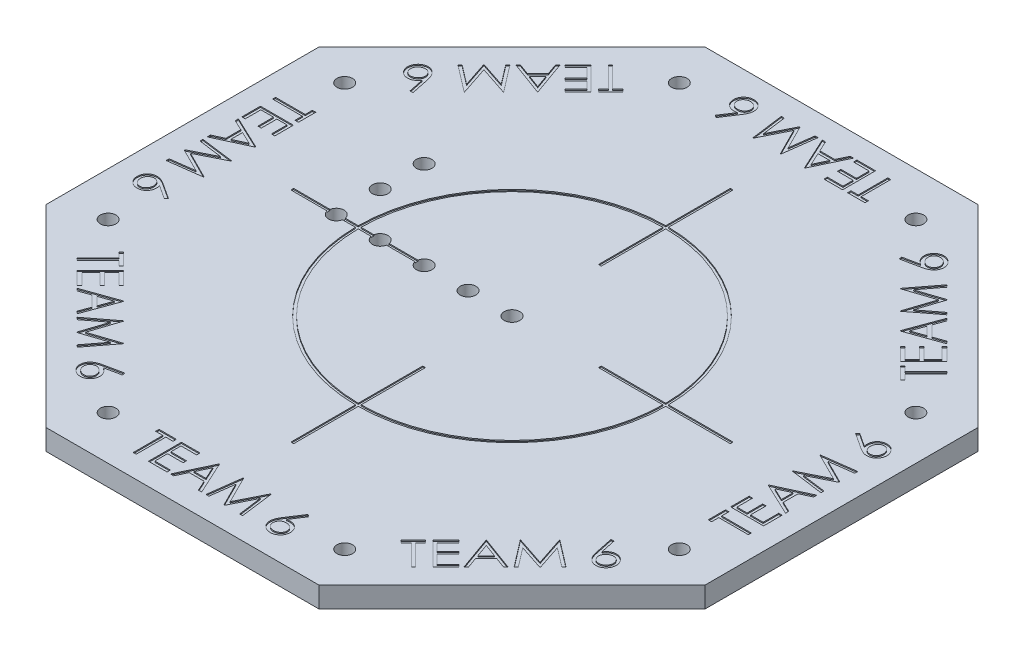
from build123d import *

# Parameters (mm, degrees)
BASE_DEPTH              = 5.9944
MOUNTING_HOLES_D        = 4.4958
F_8_CLEARANCE_HOLE1_D   = 4.4958
CUT_EXTRUDE1_DEPTH      = 0.3175
CIRPATTERN1_COUNT       = 8
SKETCH9_R               = 44.846875
SKETCH9_R_2             = 44.053125
SKETCH9_W               = 0.79375
SKETCH9_H               = 38.1
SKETCH9_W_2             = 38.1
SKETCH9_H_2             = 0.79375
CUT_EXTRUDE_THIN2_DEPTH = 0.3175


with BuildPart() as part:
    # Sketch1 → Base (new body)
    with BuildSketch(Plane(origin=(0, 0, 0), x_dir=(1, 0, 0), z_dir=(0, 1, 0))):
        Polygon((-39.453841816, 95.25), (-95.25, 39.453841816), (-95.25, -39.453841816), (-39.453841816, -95.25), (39.453841816, -95.25), (95.25, -39.453841816), (95.25, 39.453841816), (39.453841816, 95.25), align=None)
    extrude(amount=BASE_DEPTH)

    # Mounting holes (through all)
    with Locations(Plane(origin=(0, 5.9944, 0), x_dir=(1, 0, 0), z_dir=(0, 1, 0))):
        with Locations((-34.193329574, 82.55), (34.193329574, 82.55), (82.55, 34.193329574), (82.55, -34.193329574), (34.193329574, -82.55), (-34.193329574, -82.55), (-82.55, -34.193329574), (-82.55, 34.193329574)):
            Hole(MOUNTING_HOLES_D / 2)

    # #8 Clearance Hole1 (through all)
    with Locations(Plane(origin=(0, 5.9944, 0), x_dir=(1, 0, 0), z_dir=(0, 1, 0))):
        with Locations((0, 0), (-12.7, 0), (-25.4, 0), (-38.1, 0), (-50.8, 0), (-50.8, 12.7), (-50.8, 25.4)):
            Hole(F_8_CLEARANCE_HOLE1_D / 2)

    # Sketch8 → Cut-Extrude1 (cut)
    # profile 1 of 5: a face of its own
    with BuildSketch(Plane(origin=(0, 5.9944, 0), x_dir=(1, 0, 0), z_dir=(0, 1, 0))):
        Polygon((-22.652403846, -80.351923077), (-22.652403846, -79.375), (-17.645673077, -79.375), (-17.645673077, -80.351923077), (-19.721634615, -80.351923077), (-19.721634615, -88.9), (-20.576442308, -88.9), (-20.576442308, -80.351923077), align=None)
    # profile 2 of 5: a face of its own
    with BuildSketch(Plane(origin=(0, 5.9944, 0), x_dir=(1, 0, 0), z_dir=(0, 1, 0))):
        Polygon((-16.180288462, -79.375), (-10.807211538, -79.375), (-10.807211538, -80.351923077), (-15.325480769, -80.351923077), (-15.325480769, -83.282692308), (-10.807211538, -83.282692308), (-10.807211538, -84.259615385), (-15.325480769, -84.259615385), (-15.325480769, -87.923076923), (-10.807211538, -87.923076923), (-10.807211538, -88.9), (-16.180288462, -88.9), align=None)
    # profile 3 of 5: a face of its own
    with BuildSketch(Plane(origin=(0, 5.9944, 0), x_dir=(1, 0, 0), z_dir=(0, 1, 0))):
        Polygon((-5.189903846, -79.375), (-0.79375, -88.9), (-1.722971755, -88.9), (-3.131114784, -85.847115385), (-7.449038462, -85.847115385), (-8.897250601, -88.9), (-9.830288462, -88.9), (-5.312019231, -79.375), align=None)
        Polygon((-5.260501803, -81.231535457), (-6.985381611, -84.870192308), (-3.581415264, -84.870192308), align=None, mode=Mode.SUBTRACT)
    # profile 4 of 5: a face of its own
    with BuildSketch(Plane(origin=(0, 5.9944, 0), x_dir=(1, 0, 0), z_dir=(0, 1, 0))):
        Polygon((0.427403846, -88.9), (1.684810697, -79.375), (1.806926082, -79.375), (5.739423077, -87.190384615), (9.662379808, -79.375), (9.786403245, -79.375), (11.051442308, -88.9), (10.19281851, -88.9), (9.280769231, -82.046274038), (5.842457933, -88.9), (5.649744591, -88.9), (2.198076923, -82.031009615), (1.287935697, -88.9), align=None)
    # profile 5 of 5: a face of its own
    with BuildSketch(Plane(origin=(0, 5.9944, 0), x_dir=(1, 0, 0), z_dir=(0, 1, 0))):
        with BuildLine():
            Line((20.210096154, -79.130769231), (20.868374399, -79.647851563))
            Line((20.868374399, -79.647851563), (18.351652644, -83.496394231))
            add(Edge.make_bspline(
                [(18.351652644, -83.496394231), (18.519211755, -83.46968651), (18.846054746, -83.417590081), (19.176887656, -83.408995958), (19.338115986, -83.404807692)],
                knots=[0, 0, 0, 0, 1.025318673, 2, 2, 2, 2], degree=3))
            add(Edge.make_bspline(
                [(19.338115986, -83.404807692), (19.434923993, -83.407409682), (19.625487676, -83.412531621), (19.905269045, -83.451948386), (20.174116078, -83.514065298), (20.430914465, -83.604613366), (20.676585938, -83.720280488), (20.912540315, -83.858906985), (21.134342214, -84.027651015), (21.344847924, -84.216150644), (21.535965953, -84.424930438), (21.705173647, -84.646458361), (21.84730513, -84.880503616), (21.962622731, -85.126947658), (22.052171008, -85.3854106), (22.11745167, -85.655561751), (22.156040419, -85.937587399), (22.161280505, -86.129388719), (22.163942308, -86.226817909)],
                knots=[0, 0, 0, 0, 1.04369286, 2.054478336, 3.041073146, 4.015093852, 4.984733326, 5.965804835, 6.960378782, 7.985147595, 9.009457201, 10.008161701, 10.986880575, 11.956520048, 12.937015923, 13.931873656, 14.949455224, 16, 16, 16, 16], degree=3))
            add(Edge.make_bspline(
                [(22.163942308, -86.226817909), (22.160069429, -86.360112674), (22.152448521, -86.622405228), (22.076510334, -87.004430408), (21.958510158, -87.368373896), (21.789842741, -87.708425027), (21.580340685, -88.024117734), (21.324859522, -88.303841037), (21.032459743, -88.553314495), (20.701842099, -88.761930009), (20.346034461, -88.932299741), (19.972240811, -89.054669435), (19.58409122, -89.13000802), (19.320644394, -89.139453017), (19.187379808, -89.144230769)],
                knots=[0, 0, 0, 0, 1.031375318, 2.029502543, 3.004789286, 3.987476834, 4.960371455, 5.9300674, 6.912260825, 7.929083631, 8.949397511, 9.960523116, 10.96833055, 12, 12, 12, 12], degree=3))
            add(Edge.make_bspline(
                [(19.187379808, -89.144230769), (19.059209501, -89.140071866), (18.805326564, -89.131833808), (18.431857317, -89.058447934), (18.073001534, -88.939502176), (17.731273433, -88.775633318), (17.414715194, -88.568647222), (17.131507997, -88.31946702), (16.883063954, -88.033419119), (16.67630445, -87.710547888), (16.512314615, -87.363593075), (16.389333461, -87.001814099), (16.317497971, -86.626529149), (16.307459827, -86.372126906), (16.302403846, -86.243990385)],
                knots=[0, 0, 0, 0, 1.012016664, 2.004627821, 2.994792927, 3.992885782, 4.990978636, 5.973936114, 6.964471063, 7.975201453, 8.993600317, 9.990122807, 10.98767138, 12, 12, 12, 12], degree=3))
            add(Edge.make_bspline(
                [(16.302403846, -86.243990385), (16.305619064, -86.145897626), (16.312183926, -85.945610955), (16.358022009, -85.642269565), (16.431676915, -85.331887692), (16.514164086, -85.068578066), (16.601319496, -84.852873495), (16.673852478, -84.67896471), (16.764133139, -84.500000646), (16.860399269, -84.309844537), (16.971316177, -84.113397038), (17.091918051, -83.907374909), (17.225539244, -83.695054692), (17.319211258, -83.550970846), (17.367097356, -83.477313702)],
                knots=[0, 0, 0, 0, 1.173818275, 2.396712641, 3.66331629, 4.989737886, 5.693666774, 6.447286557, 7.243889047, 8.091586357, 8.998013824, 9.943181721, 10.948533338, 12, 12, 12, 12], degree=3))
            Line((17.367097356, -83.477313702), (20.210096154, -79.130769231))
        make_face()
        with BuildLine():
            add(Edge.make_bspline(
                [(19.158759014, -84.381730769), (19.08619962, -84.38384816), (18.944470043, -84.387984038), (18.736532722, -84.412001331), (18.539737373, -84.457228931), (18.351476745, -84.514831591), (18.175270497, -84.594033489), (18.009838011, -84.690240885), (17.854539548, -84.803509948), (17.71100174, -84.932235999), (17.580863942, -85.073173432), (17.468792436, -85.224129774), (17.372120761, -85.381466999), (17.293520954, -85.546499713), (17.232315819, -85.71916483), (17.188042937, -85.898668215), (17.163403799, -86.086213577), (17.159304698, -86.213392745), (17.157211538, -86.278335337)],
                knots=[0, 0, 0, 0, 1.129588631, 2.206414736, 3.251139165, 4.268635594, 5.265702196, 6.250456724, 7.242448911, 8.251968645, 9.246821453, 10.222880186, 11.173611482, 12.116736599, 13.062300278, 14.020270554, 14.989073742, 16, 16, 16, 16], degree=3))
            add(Edge.make_bspline(
                [(17.157211538, -86.278335337), (17.158916136, -86.342697068), (17.162258599, -86.46890084), (17.192608841, -86.654881036), (17.238968601, -86.833855537), (17.307930678, -87.004901674), (17.390190996, -87.170626653), (17.498790485, -87.32502768), (17.619123309, -87.4774823), (17.762961514, -87.616279161), (17.917330094, -87.745428974), (18.082251938, -87.858314521), (18.254137258, -87.954887607), (18.435306628, -88.030573523), (18.623189659, -88.092688189), (18.819351738, -88.136398358), (19.023929295, -88.161110361), (19.162509712, -88.165214802), (19.233173077, -88.167307692)],
                knots=[0, 0, 0, 0, 0.989467248, 1.94019797, 2.891935182, 3.827694429, 4.772920941, 5.730924762, 6.725747692, 7.756678648, 8.79901574, 9.819492441, 10.826891316, 11.826466727, 12.835195252, 13.867842842, 14.912794438, 16, 16, 16, 16], degree=3))
            add(Edge.make_bspline(
                [(19.233173077, -88.167307692), (19.303836326, -88.165214638), (19.442416516, -88.161109875), (19.646995719, -88.136400205), (19.843151715, -88.092681413), (20.031056856, -88.030598088), (20.212144608, -87.954796479), (20.3838796, -87.858915326), (20.547241769, -87.744734748), (20.701711686, -87.616499869), (20.84495119, -87.476692322), (20.96817007, -87.326388577), (21.073443726, -87.169378762), (21.158989621, -87.005554504), (21.227192135, -86.833752113), (21.273786985, -86.654908743), (21.30407455, -86.468893587), (21.307425625, -86.342694618), (21.309134615, -86.278335337)],
                knots=[0, 0, 0, 0, 1.087397944, 2.132534446, 3.165364764, 4.174271784, 5.174024072, 6.181601208, 7.194203697, 8.236725232, 9.267838612, 10.269026844, 11.221737037, 12.171628256, 13.107553087, 14.05945871, 15.010357665, 16, 16, 16, 16], degree=3))
            add(Edge.make_bspline(
                [(21.309134615, -86.278335337), (21.307637032, -86.213308023), (21.304697764, -86.085680554), (21.271452932, -85.898752108), (21.225345472, -85.718252796), (21.155723081, -85.545317035), (21.065272199, -85.380627262), (20.955099498, -85.223351548), (20.827648003, -85.072284103), (20.680425413, -84.931959603), (20.520159848, -84.803652198), (20.349756005, -84.690387548), (20.171480734, -84.594797433), (19.98551479, -84.515040247), (19.789727374, -84.457483464), (19.58727938, -84.412162853), (19.375581512, -84.388045504), (19.231953742, -84.383862491), (19.158759014, -84.381730769)],
                knots=[0, 0, 0, 0, 0.978206639, 1.919901502, 2.851605144, 3.780102724, 4.718870031, 5.675451981, 6.667674623, 7.690630536, 8.733308323, 9.756129687, 10.767539656, 11.776269907, 12.797430371, 13.836405707, 14.897401972, 16, 16, 16, 16], degree=3))
        make_face(mode=Mode.SUBTRACT)
    cut_extrude1 = extrude(amount=-CUT_EXTRUDE1_DEPTH, mode=Mode.SUBTRACT)

    # CirPattern1: Cut-Extrude1 ×8 about axis
    cirpattern1_axis = Axis((0, 6.29412, 0), (0, -1, 0))
    for i in range(1, CIRPATTERN1_COUNT):
        add(cut_extrude1.rotate(cirpattern1_axis, i * 360 / CIRPATTERN1_COUNT), mode=Mode.SUBTRACT)

    # Sketch9 → Cut-Extrude-Thin2 (cut)
    # profile 1 of 5: a face of its own
    with BuildSketch(Plane(origin=(0, 5.9944, 0), x_dir=(1, 0, 0), z_dir=(0, 1, 0))):
        Circle(SKETCH9_R)
        Circle(SKETCH9_R_2, mode=Mode.SUBTRACT)
    # profile 2 of 5: a face of its own
    with BuildSketch(Plane(origin=(0, 5.9944, 0), x_dir=(1, 0, 0), z_dir=(0, 1, 0))):
        with Locations((0, 44.45)):
            Rectangle(SKETCH9_W, SKETCH9_H)
    # profile 3 of 5: a face of its own
    with BuildSketch(Plane(origin=(0, 5.9944, 0), x_dir=(1, 0, 0), z_dir=(0, 1, 0))):
        with Locations((44.45, 0)):
            Rectangle(SKETCH9_W_2, SKETCH9_H_2)
    # profile 4 of 5: a face of its own
    with BuildSketch(Plane(origin=(0, 5.9944, 0), x_dir=(1, 0, 0), z_dir=(0, 1, 0))):
        with Locations((0, -44.45)):
            Rectangle(SKETCH9_W, SKETCH9_H)
    # profile 5 of 5: a face of its own
    with BuildSketch(Plane(origin=(0, 5.9944, 0), x_dir=(1, 0, 0), z_dir=(0, 1, 0))):
        with Locations((-44.45, 0)):
            Rectangle(SKETCH9_W_2, SKETCH9_H_2)
    extrude(amount=-CUT_EXTRUDE_THIN2_DEPTH, mode=Mode.SUBTRACT)


solid = part.part
